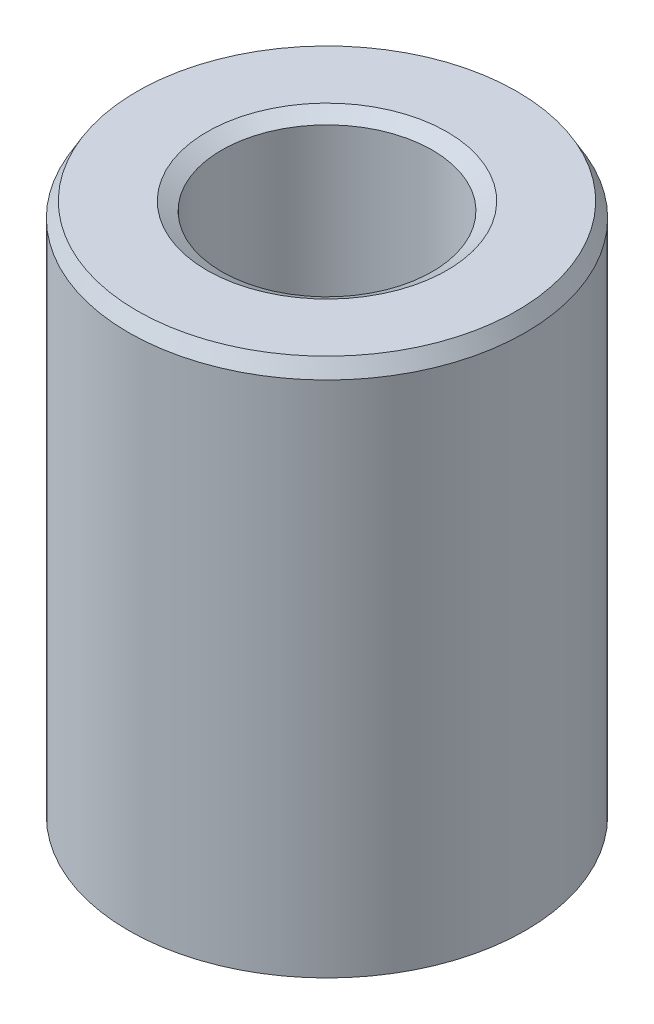
from build123d import *
from OCP.BRepFilletAPI import BRepFilletAPI_MakeChamfer

# Parameters (mm, degrees)
SKETCH1_R           = 7.5
BOSS_EXTRUDE1_DEPTH = 20.444837205
SKETCH2_R           = 3.981311517
CUT_EXTRUDE1_DEPTH  = 24.032398233
CHAMFER1_SIZE       = 0.554119491
CHAMFER1_SIZE2      = 0.319921037


with BuildPart() as part:
    # Sketch1 → Boss-Extrude1 (new body)
    with BuildSketch(Plane(origin=(0, 0, 0), x_dir=(1, 0, 0), z_dir=(0, 1, 0))):
        Circle(SKETCH1_R)
    extrude(amount=BOSS_EXTRUDE1_DEPTH)

    # Sketch2 → Cut-Extrude1 (cut, through all)
    with BuildSketch(Plane(origin=(0, 0, 0), x_dir=(1, 0, 0), z_dir=(0, 1, 0))):
        Circle(SKETCH2_R)
    extrude(amount=CUT_EXTRUDE1_DEPTH, mode=Mode.SUBTRACT)

    # Chamfer1: one chamfer whose edges measure the first distance from different faces: ONE call of the kernel's chamfer builder (chamfer() names one face for all edges)
    chamfer1_edges_1 = [part.edges().sort_by_distance(p)[0] for p in [
        (-3.981311517, 20.444837205, 0),
    ]]
    chamfer1_side_1 = [part.faces().sort_by_distance(p)[0] for p in [
        (-7.287867966, 20.444837205, 0),
    ]]
    chamfer1_edges_2 = [part.edges().sort_by_distance(p)[0] for p in [
        (-3.981311517, 0, 0),
    ]]
    chamfer1_side_2 = [part.faces().sort_by_distance(p)[0] for p in [
        (-3.981311517, 10.222418603, 0),
    ]]
    chamfer1_edges_3 = [part.edges().sort_by_distance(p)[0] for p in [
        (-7.5, 0, 0),
    ]]
    chamfer1_side_3 = [part.faces().sort_by_distance(p)[0] for p in [
        (-7.287867966, 0, 0),
    ]]
    chamfer1_edges_4 = [part.edges().sort_by_distance(p)[0] for p in [
        (-7.5, 20.444837205, 0),
    ]]
    chamfer1_side_4 = [part.faces().sort_by_distance(p)[0] for p in [
        (-7.5, 10.222418603, 0),
    ]]
    chamfer1 = BRepFilletAPI_MakeChamfer(part.part.solid().wrapped)
    for e in chamfer1_edges_1:
        chamfer1.Add(CHAMFER1_SIZE, CHAMFER1_SIZE2, e.wrapped, chamfer1_side_1[0].wrapped)  # the first distance lies on this face
    for e in chamfer1_edges_2:
        chamfer1.Add(CHAMFER1_SIZE, CHAMFER1_SIZE2, e.wrapped, chamfer1_side_2[0].wrapped)  # the first distance lies on this face
    for e in chamfer1_edges_3:
        chamfer1.Add(CHAMFER1_SIZE, CHAMFER1_SIZE2, e.wrapped, chamfer1_side_3[0].wrapped)  # the first distance lies on this face
    for e in chamfer1_edges_4:
        chamfer1.Add(CHAMFER1_SIZE, CHAMFER1_SIZE2, e.wrapped, chamfer1_side_4[0].wrapped)  # the first distance lies on this face
    add(Compound.cast(chamfer1.Shape()), mode=Mode.REPLACE)


solid = part.part
